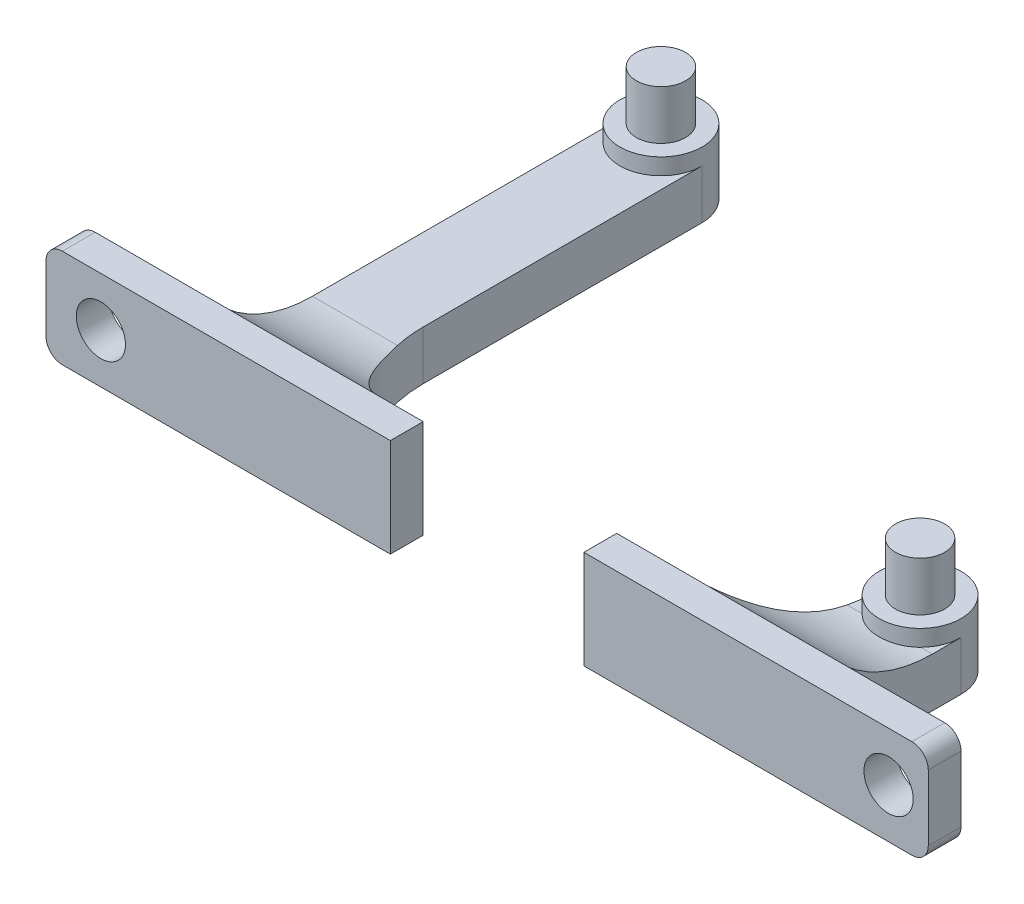
from build123d import *

# Parameters (mm, degrees)
SKETCH1_W           = 5
SKETCH1_H           = 5
BOSS_EXTRUDE1_DEPTH = 3
BOSS_EXTRUDE2_DEPTH = 4
BOSS_EXTRUDE3_DEPTH = 7
SKETCH2_W           = 53.8
SKETCH2_H           = 6
BOSS_EXTRUDE4_DEPTH = 2
FILLET2_R           = 1
FILLET3_R           = 8
FILLET4_R           = 1
SKETCH4_W           = 11.8
SKETCH4_H           = 2
CUT_EXTRUDE2_DEPTH  = 34.478537919
SKETCH5_R           = 1.5
CUT_EXTRUDE3_DEPTH  = 2


with BuildPart() as part:
    # Sketch1 → Boss-Extrude1 (new body)
    with BuildSketch(Plane(origin=(0, 0, 0), x_dir=(1, 0, 0), z_dir=(0, 1, 0))):
        with BuildLine():
            Line((-18.55, 8.5), (-18.55, -11.5))
            Line((-18.55, -11.5), (-13.55, -11.5))
            Line((-13.55, -11.5), (-13.55, 8.5))
            ThreePointArc((-13.55, 8.5), (-16.05, 6), (-18.55, 8.5))
        make_face()
        with Locations((-16.05, -14)):
            Rectangle(SKETCH1_W, SKETCH1_H)
        with Locations((16.75, -14)):
            Rectangle(SKETCH1_W, SKETCH1_H)
        with BuildLine():
            Line((14.25, -11.5), (19.25, -11.5))
            Line((19.25, -11.5), (19.25, -8.5))
            ThreePointArc((19.25, -8.5), (16.75, -11), (14.25, -8.5))
            Line((14.25, -8.5), (14.25, -11.5))
        make_face()
    extrude(amount=BOSS_EXTRUDE1_DEPTH)

    # Sketch1<3> → Boss-Extrude2 (add)
    with BuildSketch(Plane(origin=(0, 0, 0), x_dir=(1, 0, 0), z_dir=(0, 1, 0))):
        with BuildLine():
            ThreePointArc((-13.55, 8.5), (-16.05, 11), (-18.55, 8.5))
            Line((-18.55, 8.5), (-17.55, 8.5))
            ThreePointArc((-17.55, 8.5), (-16.05, 10), (-14.55, 8.5))
            Line((-14.55, 8.5), (-13.55, 8.5))
        make_face()
        with BuildLine():
            Line((-17.55, 8.5), (-18.55, 8.5))
            ThreePointArc((-18.55, 8.5), (-16.05, 6), (-13.55, 8.5))
            Line((-13.55, 8.5), (-14.55, 8.5))
            ThreePointArc((-14.55, 8.5), (-16.05, 7), (-17.55, 8.5))
        make_face()
        with BuildLine():
            ThreePointArc((14.25, -8.5), (16.75, -11), (19.25, -8.5))
            Line((19.25, -8.5), (18.25, -8.5))
            ThreePointArc((18.25, -8.5), (16.75, -10), (15.25, -8.5))
            Line((15.25, -8.5), (14.25, -8.5))
        make_face()
        with BuildLine():
            Line((18.25, -8.5), (19.25, -8.5))
            ThreePointArc((19.25, -8.5), (16.75, -6), (14.25, -8.5))
            Line((14.25, -8.5), (15.25, -8.5))
            ThreePointArc((15.25, -8.5), (16.75, -7), (18.25, -8.5))
        make_face()
    extrude(amount=BOSS_EXTRUDE2_DEPTH)

    # Sketch1<4> → Boss-Extrude3 (add)
    with BuildSketch(Plane(origin=(0, 0, 0), x_dir=(1, 0, 0), z_dir=(0, 1, 0))):
        with BuildLine():
            ThreePointArc((-14.55, 8.5), (-16.05, 10), (-17.55, 8.5))
            Line((-17.55, 8.5), (-14.55, 8.5))
        make_face()
        with BuildLine():
            Line((-14.55, 8.5), (-17.55, 8.5))
            ThreePointArc((-17.55, 8.5), (-16.05, 7), (-14.55, 8.5))
        make_face()
        with BuildLine():
            ThreePointArc((15.25, -8.5), (16.75, -10), (18.25, -8.5))
            Line((18.25, -8.5), (15.25, -8.5))
        make_face()
        with BuildLine():
            Line((15.25, -8.5), (18.25, -8.5))
            ThreePointArc((18.25, -8.5), (16.75, -7), (15.25, -8.5))
        make_face()
    extrude(amount=BOSS_EXTRUDE3_DEPTH)

    # Sketch2 → Boss-Extrude4 (add)
    with BuildSketch(Plane.XY.offset(16.5)):
        with Locations((0.35, 3)):
            Rectangle(SKETCH2_W, SKETCH2_H)
    extrude(amount=BOSS_EXTRUDE4_DEPTH)

    # Fillet2
    fillet2_edges = [part.edges().sort_by_distance(p)[0] for p in [
        (-26.55, 6, 17.5),
        (-26.55, 0, 17.5),
        (27.25, 0, 17.5),
        (27.25, 6, 17.5),
    ]]
    fillet(fillet2_edges, radius=FILLET2_R)

    # Fillet3
    # the kernel refuses this fillet: 8 mm, written as the material it adds along each edge
    with BuildSketch(Plane(origin=(14.25, 0, 16.5), x_dir=(-1, 0, 0), z_dir=(0, 1, 0))) as fillet3_piece_1:
        with BuildLine():
            CenterArc((FILLET3_R, -FILLET3_R), FILLET3_R, 90, 90)
            Line((0, -FILLET3_R), (-FILLET3_R * 0.02, -FILLET3_R))
            Line((-FILLET3_R * 0.02, -FILLET3_R), (-FILLET3_R * 0.02, FILLET3_R * 0.02))
            Line((-FILLET3_R * 0.02, FILLET3_R * 0.02), (FILLET3_R, FILLET3_R * 0.02))
            Line((FILLET3_R, FILLET3_R * 0.02), (FILLET3_R, 0))
        make_face()
    extrude(amount=3)
    with BuildSketch(Plane(origin=(14.25, 3, 16.5), x_dir=(0, 1, 0), z_dir=(1, 0, 0)), Plane(origin=(-18.55, 3, 16.5), x_dir=(0, 1, 0), z_dir=(1, 0, 0))) as fillet3_piece_2:
        with BuildLine():
            CenterArc((8, -6.244997998), FILLET3_R, 128.682187453, 51.317812547)
            Line((0, -6.244997998), (-0.16, -6.244997998))
            Line((-0.16, -6.244997998), (-0.16, 0))
            Line((-0.16, 0), (0, 0.16))
            ThreePointArc((0, 0.16), (1.5, 0.16), (2.9, 0.12489996))
            Line((2.9, 0.12489996), (3, 0))
        make_face()
    extrude(amount=5)
    with BuildSketch(Plane(origin=(-13.55, 0, 16.5), x_dir=(1, 0, 0), z_dir=(0, 1, 0))) as fillet3_piece_3:
        with BuildLine():
            CenterArc((FILLET3_R, FILLET3_R), FILLET3_R, 180, 90)
            Line((0, FILLET3_R), (-FILLET3_R * 0.02, FILLET3_R))
            Line((-FILLET3_R * 0.02, FILLET3_R), (-FILLET3_R * 0.02, -FILLET3_R * 0.02))
            Line((-FILLET3_R * 0.02, -FILLET3_R * 0.02), (FILLET3_R, -FILLET3_R * 0.02))
            Line((FILLET3_R, -FILLET3_R * 0.02), (FILLET3_R, 0))
        make_face()
    extrude(amount=3)
    with BuildSketch(Plane(origin=(14.25, 0, 16.5), x_dir=(-1, 0, 0), z_dir=(0, 1, 0))) as fillet3_piece_4a_section:
        with BuildLine():
            CenterArc((FILLET3_R, -FILLET3_R), FILLET3_R, 90, 90)
            Line((0, -FILLET3_R), (-FILLET3_R * 0.02, -FILLET3_R))
            Line((-FILLET3_R * 0.02, -FILLET3_R), (-FILLET3_R * 0.02, FILLET3_R * 0.02))
            Line((-FILLET3_R * 0.02, FILLET3_R * 0.02), (FILLET3_R, FILLET3_R * 0.02))
            Line((FILLET3_R, FILLET3_R * 0.02), (FILLET3_R, 0))
        make_face()
    fillet3_piece_4a = extrude(amount=23, mode=Mode.PRIVATE)
    fillet3_piece_4a = split(fillet3_piece_4a, bisect_by=Plane(origin=(12.438839086, 6, 14.688839086), z_dir=(0, -1, 0)), keep=Keep.TOP, mode=Mode.PRIVATE)
    fillet3_piece_4a = split(fillet3_piece_4a, bisect_by=Plane(origin=(12.438839086, 3, 14.688839086), z_dir=(0, 1, 0)), keep=Keep.TOP, mode=Mode.PRIVATE)
    with BuildSketch(Plane(origin=(-1.362494996, 3, 16.5), x_dir=(0, 1, 0), z_dir=(1, 0, 0))) as fillet3_piece_4b_section:
        with BuildLine():
            CenterArc((8, -6.244997998), FILLET3_R, 128.682187453, 51.317812547)
            Line((0, -6.244997998), (-0.16, -6.244997998))
            Line((-0.16, -6.244997998), (-0.16, 0))
            Line((-0.16, 0), (0, 0.16))
            ThreePointArc((0, 0.16), (1.5, 0.16), (2.9, 0.12489996))
            Line((2.9, 0.12489996), (3, 0))
        make_face()
    fillet3_piece_4b = extrude(amount=20.612494996, mode=Mode.PRIVATE)
    fillet3_piece_4b = split(fillet3_piece_4b, bisect_by=Plane(origin=(14.25, 3.763389278, 14.878987527), z_dir=(-1, 0, 0)), keep=Keep.TOP, mode=Mode.PRIVATE)
    fillet3_piece_4 = fillet3_piece_4a & fillet3_piece_4b
    add(fillet3_piece_4)
    with BuildSketch(Plane(origin=(-18.55, 3, 16.5), x_dir=(0, 1, 0), z_dir=(1, 0, 0))) as fillet3_piece_5a_section:
        with BuildLine():
            CenterArc((8, -6.244997998), FILLET3_R, 128.682187453, 51.317812547)
            Line((0, -6.244997998), (-0.16, -6.244997998))
            Line((-0.16, -6.244997998), (-0.16, 0))
            Line((-0.16, 0), (0, 0.16))
            ThreePointArc((0, 0.16), (1.5, 0.16), (2.9, 0.12489996))
            Line((2.9, 0.12489996), (3, 0))
        make_face()
    fillet3_piece_5a = extrude(amount=20.612494996, mode=Mode.PRIVATE)
    fillet3_piece_5a = split(fillet3_piece_5a, bisect_by=Plane(origin=(-13.55, 3.763389278, 14.878987527), z_dir=(1, 0, 0)), keep=Keep.TOP, mode=Mode.PRIVATE)
    with BuildSketch(Plane(origin=(-13.55, 0, 16.5), x_dir=(1, 0, 0), z_dir=(0, 1, 0))) as fillet3_piece_5b_section:
        with BuildLine():
            CenterArc((FILLET3_R, FILLET3_R), FILLET3_R, 180, 90)
            Line((0, FILLET3_R), (-FILLET3_R * 0.02, FILLET3_R))
            Line((-FILLET3_R * 0.02, FILLET3_R), (-FILLET3_R * 0.02, -FILLET3_R * 0.02))
            Line((-FILLET3_R * 0.02, -FILLET3_R * 0.02), (FILLET3_R, -FILLET3_R * 0.02))
            Line((FILLET3_R, -FILLET3_R * 0.02), (FILLET3_R, 0))
        make_face()
    fillet3_piece_5b = extrude(amount=23, mode=Mode.PRIVATE)
    fillet3_piece_5b = split(fillet3_piece_5b, bisect_by=Plane(origin=(-11.738839086, 6, 14.688839086), z_dir=(0, -1, 0)), keep=Keep.TOP, mode=Mode.PRIVATE)
    fillet3_piece_5b = split(fillet3_piece_5b, bisect_by=Plane(origin=(-11.738839086, 3, 14.688839086), z_dir=(0, 1, 0)), keep=Keep.TOP, mode=Mode.PRIVATE)
    fillet3_piece_5 = fillet3_piece_5a & fillet3_piece_5b
    add(fillet3_piece_5)

    # Fillet4
    # the kernel refuses this fillet: 1 mm, written as the material it adds along each edge
    with BuildSketch(Plane(origin=(19.25, 6, 16.5), x_dir=(1, 0, 0), z_dir=(0, -1, 0))) as fillet4_piece_1_section:
        with BuildLine():
            CenterArc((FILLET4_R, -FILLET4_R), FILLET4_R, 90, 90)
            Line((0, -FILLET4_R), (0, 0))
            Line((0, 0), (FILLET4_R, 0))
        make_face()
    fillet4_piece_1 = extrude(amount=6, mode=Mode.PRIVATE)
    fillet4_piece_1 = fillet4_piece_1 - Plane(origin=(19.481697463, 11, 10.255002002), x_dir=(0, 1, 0), z_dir=(-1, 0, 0)) * Cylinder(8, 17, mode=Mode.PRIVATE)
    add(fillet4_piece_1)
    with BuildSketch(Plane(origin=(-18.55, 6, 16.5), x_dir=(-1, 0, 0), z_dir=(0, -1, 0))) as fillet4_piece_2_section:
        with BuildLine():
            CenterArc((FILLET4_R, FILLET4_R), FILLET4_R, 180, 90)
            Line((0, FILLET4_R), (0, 0))
            Line((0, 0), (FILLET4_R, 0))
        make_face()
    fillet4_piece_2 = extrude(amount=6, mode=Mode.PRIVATE)
    fillet4_piece_2 = fillet4_piece_2 - Plane(origin=(-18.781697463, 11, 10.255002002), x_dir=(0, 1, 0), z_dir=(-1, 0, 0)) * Cylinder(8, 17, mode=Mode.PRIVATE)
    add(fillet4_piece_2)

    # Sketch4 → Cut-Extrude2 (cut, through all)
    with BuildSketch(Plane(origin=(0, 6, 0), x_dir=(1, 0, 0), z_dir=(0, 1, 0))):
        with Locations((0.35, -17.5)):
            Rectangle(SKETCH4_W, SKETCH4_H)
    extrude(amount=-CUT_EXTRUDE2_DEPTH, mode=Mode.SUBTRACT)


with BuildPart() as cut_extrude2_piece_1:
    # of the separate pieces the step leaves, piece 1, a body of its own (cut_extrude2_pieces)
    add(part.part.solids().sort_by_distance((-18.55, 4.959305007, 15.5))[0])


with BuildPart() as cut_extrude2_piece_2:
    # of the separate pieces the step leaves, piece 2, a body of its own (cut_extrude2_pieces)
    add(part.part.solids().sort_by_distance((6.25, 0, 16.5))[0])


with BuildPart() as cut_extrude3_tool:
    # Sketch5 → Cut-Extrude3 (new body)
    with BuildSketch(Plane(origin=(0, 0, 16.5), x_dir=(-1, 0, 0), z_dir=(0, 0, -1))):
        with Locations((23.203442322, 3)):
            Circle(SKETCH5_R)
        with Locations((-24.829403808, 3)):
            Circle(SKETCH5_R)
    extrude(amount=-CUT_EXTRUDE3_DEPTH)


with BuildPart() as cut_extrude2_piece_1_1:
    add(cut_extrude2_piece_1.part)

    # Cut-Extrude3: cut by cut_extrude3_tool
    add(cut_extrude3_tool.part, mode=Mode.SUBTRACT)


with BuildPart() as cut_extrude2_piece_2_1:
    add(cut_extrude2_piece_2.part)

    # Cut-Extrude3: cut by cut_extrude3_tool
    add(cut_extrude3_tool.part, mode=Mode.SUBTRACT)


solid = Compound([cut_extrude2_piece_1_1.part, cut_extrude2_piece_2_1.part])
